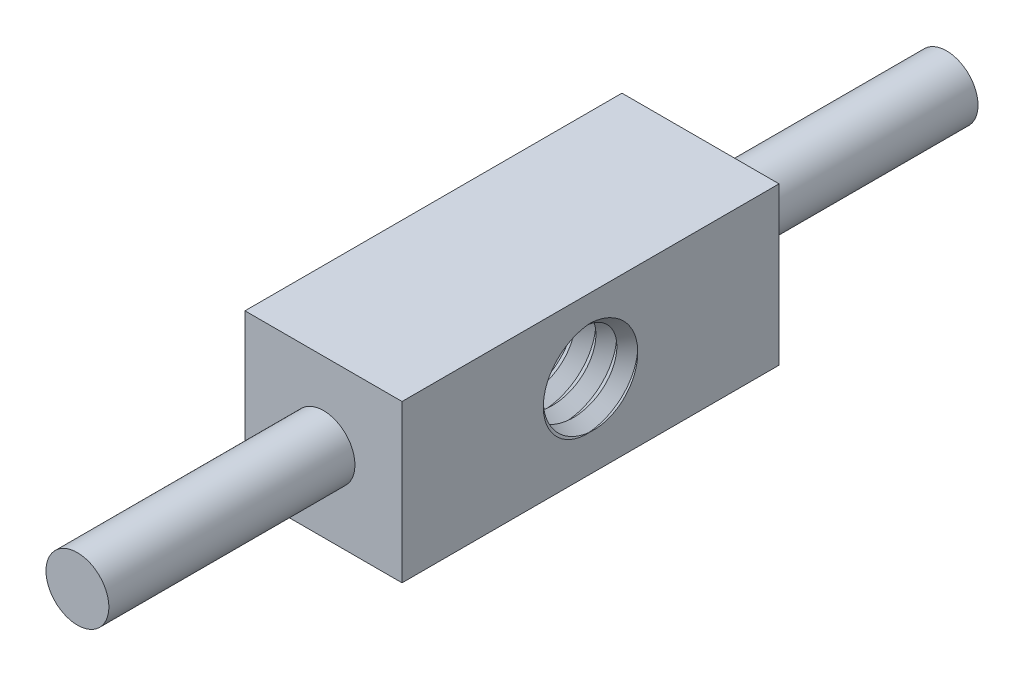
from build123d import *

# Parameters (mm, degrees)
SKETCH2_W           = 150
SKETCH2_H           = 150
BOSS_EXTRUDE1_DEPTH = 180
SKETCH5_R           = 30
BOSS_EXTRUDE3_DEPTH = 235
SKETCH7_R           = 50
CUT_EXTRUDE1_DEPTH  = 448.993409814
SKETCH9_R           = 50
SKETCH9_R_2         = 40
BOSS_EXTRUDE4_DEPTH = 150
CUT_SWEEP2_PITCH    = 20


with BuildPart() as part:
    # Sketch2 → Boss-Extrude1 (new body)
    with BuildSketch(Plane.XY):
        with Locations((22.391402768, 2.285802295)):
            Rectangle(SKETCH2_W, SKETCH2_H)
    boss_extrude1 = extrude(amount=BOSS_EXTRUDE1_DEPTH)

    # Sketch5 → Boss-Extrude3 (add)
    with BuildSketch(Plane.XY.offset(180)):
        with Locations(Location((22.391402768, 2.285802295, 0), (0, 0, 180))):
            Circle(SKETCH5_R)
    boss_extrude3 = extrude(amount=BOSS_EXTRUDE3_DEPTH)

    # Mirror1: Boss-Extrude1, Boss-Extrude3 across plane
    add(boss_extrude1.mirror(Plane.XY))
    add(boss_extrude3.mirror(Plane.XY))

    # Sketch7 → Cut-Extrude1 (cut, through all)
    with BuildSketch(Plane(origin=(97.391402768, 0, 0), x_dir=(0, 0, -1), z_dir=(1, 0, 0))):
        with Locations((0, 2.285802295)):
            Circle(SKETCH7_R)
    extrude(amount=-CUT_EXTRUDE1_DEPTH, mode=Mode.SUBTRACT)

    # Sketch9 → Boss-Extrude4 (add, through all)
    with BuildSketch(Plane(origin=(97.391402768, 0, 0), x_dir=(0, 0, -1), z_dir=(1, 0, 0))):
        with Locations((0, 2.285802295)):
            Circle(SKETCH9_R)
        with Locations((0, 2.285802295)):
            Circle(SKETCH9_R_2, mode=Mode.SUBTRACT)
    extrude(amount=-BOSS_EXTRUDE4_DEPTH)

    # Cut-Sweep2: arcs per turn and ends read off the stored shape
    # Cut-Sweep2: the profile of Sketch13 screwed along a right-hand helix through 13 turns, 20 arcs to a turn; built about Z, then put on its axis
    cut_sweep2_z = Axis((0, 0, 0), (0, 0, 1))
    cut_sweep2_corners = [(40, 0, -50), (36.541894937, 0, -50), (36.541894937, 0, -30), (40, 0, -30), (50, 0, -40)]
    with BuildLine(mode=Mode.PRIVATE) as cut_sweep2_profile:
        Line(cut_sweep2_corners[0], cut_sweep2_corners[1])
        Line(cut_sweep2_corners[1], cut_sweep2_corners[2])
        Line(cut_sweep2_corners[2], cut_sweep2_corners[3])
        Line(cut_sweep2_corners[3], cut_sweep2_corners[4])
        Line(cut_sweep2_corners[4], cut_sweep2_corners[0])
    cut_sweep2_cap = Face(cut_sweep2_profile.wire())
    cut_sweep2_turn_angles = [0, 9, 18, 27, 36, 45, 54, 63, 72, 81, 90, 99, 108, 117, 126, 135, 144, 153, 162, 171, 180, 189, 198, 207, 216, 225, 234, 243, 252, 261, 270, 279, 288, 297, 306, 315, 324, 333, 342, 351, 360]
    cut_sweep2_turn_weights = [1, 0.9876883405951378, 1, 0.9876883405951378, 1, 0.9876883405951378, 1, 0.9876883405951378, 1, 0.9876883405951378, 1, 0.9876883405951378, 1, 0.9876883405951378, 1, 0.9876883405951378, 1, 0.9876883405951378, 1, 0.9876883405951378, 1, 0.9876883405951378, 1, 0.9876883405951378, 1, 0.9876883405951378, 1, 0.9876883405951378, 1, 0.9876883405951378, 1, 0.9876883405951378, 1, 0.9876883405951378, 1, 0.9876883405951378, 1, 0.9876883405951378, 1, 0.9876883405951378, 1]
    cut_sweep2_turn_rails = [Edge.make_bspline([Vector(p[0], p[1], 0).rotate(cut_sweep2_z, cut_sweep2_turn_angles[k]) / cut_sweep2_turn_weights[k] + Vector(0, 0, p[2] + CUT_SWEEP2_PITCH * cut_sweep2_turn_angles[k] / 360) for k in range(41)], [0, 0, 0, 1, 1, 2, 2, 3, 3, 4, 4, 5, 5, 6, 6, 7, 7, 8, 8, 9, 9, 10, 10, 11, 11, 12, 12, 13, 13, 14, 14, 15, 15, 16, 16, 17, 17, 18, 18, 19, 19, 20, 20, 20], 2, cut_sweep2_turn_weights) for p in cut_sweep2_corners]
    cut_sweep2_turn_sides = [Face.make_surface_from_curves(cut_sweep2_turn_rails[p[0]], cut_sweep2_turn_rails[p[1]]) for p in [(0, 1), (1, 2), (2, 3), (3, 4), (4, 0)]]
    cut_sweep2_turn = Solid(Shell([*cut_sweep2_turn_sides, cut_sweep2_cap, cut_sweep2_cap.rotate(cut_sweep2_z, 360).moved(Location((0, 0, CUT_SWEEP2_PITCH * 360 / 360)))]))
    cut_sweep2_each = [*[cut_sweep2_turn.moved(Location((0, 0, CUT_SWEEP2_PITCH * i))) for i in range(13)]]
    add(Plane(origin=(97.391402768, 2.285802295, 0), x_dir=(0, 1, 0), z_dir=(-1, 0, 0)) * Compound([cut_sweep2_each[i] for i in range(0, 13, 2)]), mode=Mode.SUBTRACT)
    add(Plane(origin=(97.391402768, 2.285802295, 0), x_dir=(0, 1, 0), z_dir=(-1, 0, 0)) * Compound([cut_sweep2_each[i] for i in range(1, 13, 2)]), mode=Mode.SUBTRACT)


solid = part.part
